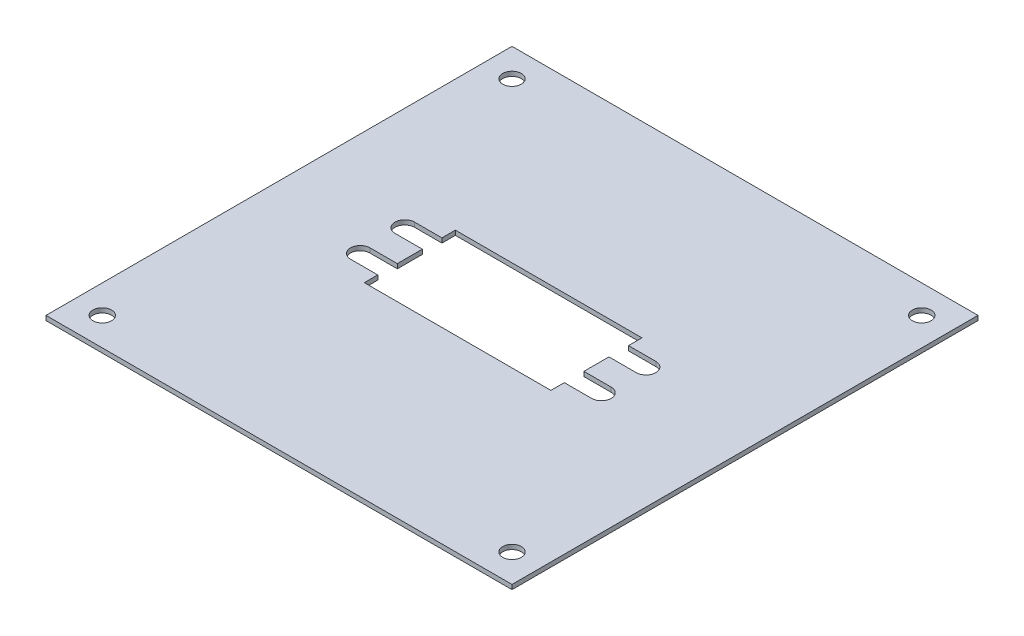
from build123d import *

# Parameters (mm, degrees)
SKETCH1_W          = 102.4
SKETCH1_H          = 102.4
SKETCH1_R          = 2.05
SKETCH1_W_2        = 41
SKETCH1_H_2        = 20
BASE_FLANGE1_DEPTH = 1
CUT_EXTRUDE2_DEPTH = 10


# Sheet-metal steps are written as plain solids
with BuildPart() as part:
    # Sketch1 → Base-Flange1 (new body)
    with BuildSketch(Plane(origin=(0, 0, 0), x_dir=(1, 0, 0), z_dir=(0, 1, 0))):
        Rectangle(SKETCH1_W, SKETCH1_H)
        with Locations(Location((45.02, 45.02, 0), (0, 0, 270))):
            Circle(SKETCH1_R, mode=Mode.SUBTRACT)
        with Locations(Location((45.02, -45.02, 0), (0, 0, 270))):
            Circle(SKETCH1_R, mode=Mode.SUBTRACT)
        with Locations(Location((-45.02, -45.02, 0), (0, 0, 270))):
            Circle(SKETCH1_R, mode=Mode.SUBTRACT)
        with Locations(Location((-45.02, 45.02, 0), (0, 0, 270))):
            Circle(SKETCH1_R, mode=Mode.SUBTRACT)
        with Locations((-1.95, 0)):
            Rectangle(SKETCH1_W_2, SKETCH1_H_2, mode=Mode.SUBTRACT)
    extrude(amount=-BASE_FLANGE1_DEPTH)

    # Sketch7 → Cut-Extrude2 (cut)
    with BuildSketch(Plane(origin=(0, 0, 0), x_dir=(1, 0, 0), z_dir=(0, 1, 0))):
        with BuildLine():
            Line((-28.45, 7.05), (-16.45, 7.05))
            ThreePointArc((-16.45, 7.05), (-14.3, 4.9), (-16.45, 2.75))
            Line((-16.45, 2.75), (-28.45, 2.75))
            ThreePointArc((-28.45, 2.75), (-30.6, 4.9), (-28.45, 7.05))
        make_face()
        with BuildLine():
            Line((-28.45, -2.75), (-16.45, -2.75))
            ThreePointArc((-16.45, -2.75), (-14.3, -4.9), (-16.45, -7.05))
            Line((-16.45, -7.05), (-28.45, -7.05))
            ThreePointArc((-28.45, -7.05), (-30.6, -4.9), (-28.45, -2.75))
        make_face()
        with BuildLine():
            Line((12.55, 7.05), (24.55, 7.05))
            ThreePointArc((24.55, 7.05), (26.7, 4.9), (24.55, 2.75))
            Line((24.55, 2.75), (12.55, 2.75))
            ThreePointArc((12.55, 2.75), (10.4, 4.9), (12.55, 7.05))
        make_face()
        with BuildLine():
            Line((12.55, -2.75), (24.55, -2.75))
            ThreePointArc((24.55, -2.75), (26.7, -4.9), (24.55, -7.05))
            Line((24.55, -7.05), (12.55, -7.05))
            ThreePointArc((12.55, -7.05), (10.4, -4.9), (12.55, -2.75))
        make_face()
    extrude(amount=-CUT_EXTRUDE2_DEPTH, mode=Mode.SUBTRACT)


solid = part.part
